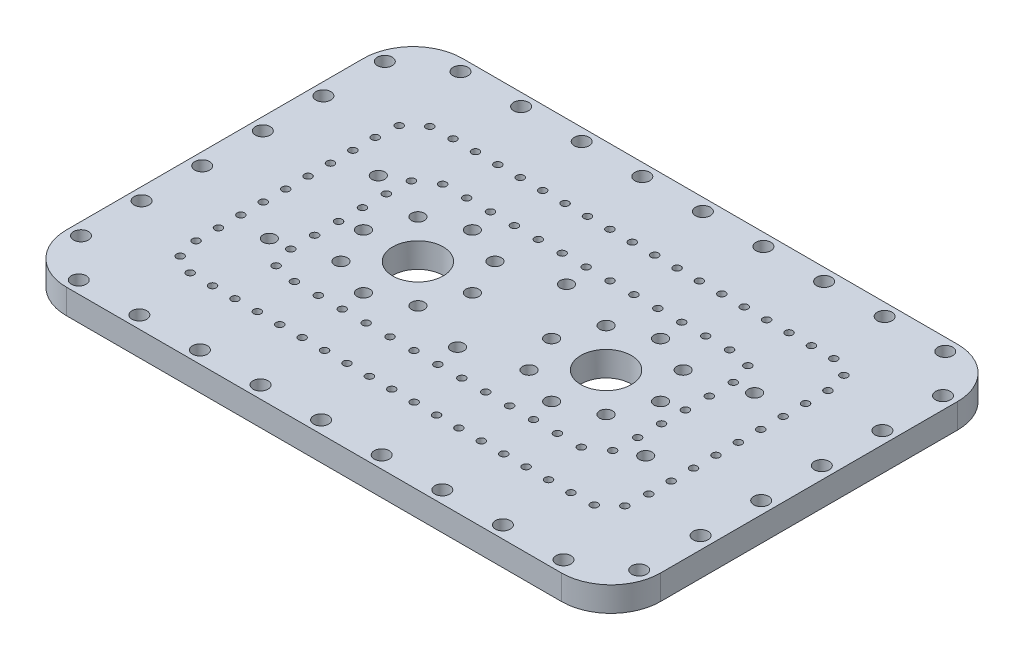
from build123d import *

# Parameters (mm, degrees)
SKETCH1_W                                        = 120
SKETCH1_H                                        = 80
BOSS_EXTRUDE1_DEPTH                              = 7
SKETCH2_W                                        = 110
SKETCH2_H                                        = 70
CUT_EXTRUDE1_DEPTH                               = 1.5
F_2_6_2_6_DIAMETER_HOLE1_D                       = 2.6
F_10_2_10_2_DIAMETER_HOLE1_D                     = 10.2
CBORE_FOR_M2_HEX_HEAD_MACHINE_SCREW1_D           = 2.6
CBORE_FOR_M2_HEX_HEAD_MACHINE_SCREW1_CBORE_D     = 5
CBORE_FOR_M2_HEX_HEAD_MACHINE_SCREW1_CBORE_DEPTH = 2.5
FILLET1_R                                        = 10
FILLET3_R                                        = 5
F_3_0MM_DOWEL_HOLE1_D                            = 3
CRVPATTERN1_OUTLINE_R                            = 1.5
CRVPATTERN1_DEPTH                                = 7
F_1_5MM_DOWEL_HOLE2_D                            = 1.5
CRVPATTERN3_OUTLINE_R                            = 0.75
CRVPATTERN3_DEPTH                                = 5.5
F_1_5MM_DOWEL_HOLE3_D                            = 1.5
CRVPATTERN4_OUTLINE_R                            = 0.75
CRVPATTERN4_DEPTH                                = 5.5
BOSS_EXTRUDE2_DEPTH                              = 1.45
SKETCH25_W                                       = 124.65453068
SKETCH25_H                                       = 86.700016861
CUT_EXTRUDE7_DEPTH                               = 2


# Read off the part's stored shape, not the designer's step: CrvPattern1, CrvPattern3, CrvPattern4
with BuildPart() as part:
    # Sketch1 → Boss-Extrude1 (new body)
    with BuildSketch(Plane(origin=(0, 7, 0), x_dir=(1, 0, 0), z_dir=(0, 1, 0))):
        Rectangle(SKETCH1_W, SKETCH1_H)
    extrude(amount=-BOSS_EXTRUDE1_DEPTH)

    # Sketch2 → Cut-Extrude1 (cut)
    with BuildSketch(Plane(origin=(0, 7, 0), x_dir=(-1, 0, 0), z_dir=(0, 1, 0))):
        Rectangle(SKETCH2_W, SKETCH2_H)
    extrude(amount=-CUT_EXTRUDE1_DEPTH, mode=Mode.SUBTRACT)

    # Ø2.6 (2.6) Diameter Hole1 (through all)
    with Locations(Plane(origin=(0, 5.5, 0), x_dir=(1, 0, 0), z_dir=(0, 1, 0))):
        with Locations((-38, -11), (0, 11), (-11.221825407, -7.778174593), (-19, -11), (-26.778174593, -7.778174593), (-26.778174593, 7.778174593), (-19, 11), (-11.221825407, 7.778174593), (11.221825407, 7.778174593), (19, 11), (26.778174593, 7.778174593), (30, 0), (26.778174593, -7.778174593), (19, -11), (11.221825407, -7.778174593), (-8, 0)):
            Hole(F_2_6_2_6_DIAMETER_HOLE1_D / 2)

    # Ø10.2 (10.2) Diameter Hole1 (through all)
    with Locations(Plane(origin=(0, 5.5, 0), x_dir=(1, 0, 0), z_dir=(0, 1, 0))):
        with Locations((19, 0), (-19, 0)):
            Hole(F_10_2_10_2_DIAMETER_HOLE1_D / 2)

    # CBORE for M2 Hex Head Machine Screw1 (through all)
    with Locations(Plane(origin=(0, 0, 0), x_dir=(-1, 0, 0), z_dir=(0, -1, 0))):
        with Locations((-8, 0), (30, 0), (38, 11), (-38, 11), (0, -11), (-38, -11), (26.778174593, -7.778174593), (38, -11), (19, -11), (11.221825407, -7.778174593), (8, 0), (11.221825407, 7.778174593), (19, 11), (26.778174593, 7.778174593), (0, 11), (-11.221825407, 7.778174593), (-19, 11), (-26.778174593, 7.778174593), (-30, 0), (-26.778174593, -7.778174593), (-19, -11), (-11.221825407, -7.778174593)):
            CounterBoreHole(CBORE_FOR_M2_HEX_HEAD_MACHINE_SCREW1_D / 2, CBORE_FOR_M2_HEX_HEAD_MACHINE_SCREW1_CBORE_D / 2, CBORE_FOR_M2_HEX_HEAD_MACHINE_SCREW1_CBORE_DEPTH)

    # Fillet1
    fillet1_edges = [part.edges().sort_by_distance(p)[0] for p in [
        (-60, 3.5, -40),
        (60, 3.5, -40),
        (60, 3.5, 40),
        (-60, 3.5, 40),
    ]]
    fillet(fillet1_edges, radius=FILLET1_R)

    # Fillet3
    fillet3_edges = [part.edges().sort_by_distance(p)[0] for p in [
        (-55, 6.25, 35),
        (-55, 6.25, -35),
        (55, 6.25, -35),
        (55, 6.25, 35),
    ]]
    fillet(fillet3_edges, radius=FILLET3_R)

    # Ø3.0mm Dowel Hole1 (through all)
    with Locations(Plane(origin=(0, 7, 0), x_dir=(1, 0, 0), z_dir=(0, 1, 0))):
        with Locations((50, 37.5)):
            Hole(F_3_0MM_DOWEL_HOLE1_D / 2)

    # CrvPattern1 outline → CrvPattern1 (cut)
    with BuildSketch(Plane(origin=(0, 0, 0), x_dir=(1, 0, 0), z_dir=(0, 1, 0))):
        with Locations((37.762537007, 37.5)):
            Circle(CRVPATTERN1_OUTLINE_R)
        with Locations((25.525074013, 37.5)):
            Circle(CRVPATTERN1_OUTLINE_R)
        with Locations((13.28761102, 37.5)):
            Circle(CRVPATTERN1_OUTLINE_R)
        with Locations((1.050148026, 37.5)):
            Circle(CRVPATTERN1_OUTLINE_R)
        with Locations((-11.187314967, 37.5)):
            Circle(CRVPATTERN1_OUTLINE_R)
        with Locations((-23.424777961, 37.5)):
            Circle(CRVPATTERN1_OUTLINE_R)
        with Locations((-35.662240954, 37.5)):
            Circle(CRVPATTERN1_OUTLINE_R)
        with Locations((-47.899703948, 37.5)):
            Circle(CRVPATTERN1_OUTLINE_R)
        with Locations((-57.320580195, 31.630676428)):
            Circle(CRVPATTERN1_OUTLINE_R)
        with Locations((-57.5, 19.406342516)):
            Circle(CRVPATTERN1_OUTLINE_R)
        with Locations((-57.5, 7.168879523)):
            Circle(CRVPATTERN1_OUTLINE_R)
        with Locations((-57.5, -5.068583471)):
            Circle(CRVPATTERN1_OUTLINE_R)
        with Locations((-57.5, -17.306046464)):
            Circle(CRVPATTERN1_OUTLINE_R)
        with Locations((-57.5, -29.543509458)):
            Circle(CRVPATTERN1_OUTLINE_R)
        with Locations((-50, -37.5)):
            Circle(CRVPATTERN1_OUTLINE_R)
        with Locations((-37.762537007, -37.5)):
            Circle(CRVPATTERN1_OUTLINE_R)
        with Locations((-25.525074013, -37.5)):
            Circle(CRVPATTERN1_OUTLINE_R)
        with Locations((-13.28761102, -37.5)):
            Circle(CRVPATTERN1_OUTLINE_R)
        with Locations((-1.050148026, -37.5)):
            Circle(CRVPATTERN1_OUTLINE_R)
        with Locations((11.187314967, -37.5)):
            Circle(CRVPATTERN1_OUTLINE_R)
        with Locations((23.424777961, -37.5)):
            Circle(CRVPATTERN1_OUTLINE_R)
        with Locations((35.662240954, -37.5)):
            Circle(CRVPATTERN1_OUTLINE_R)
        with Locations((47.899703948, -37.5)):
            Circle(CRVPATTERN1_OUTLINE_R)
        with Locations((57.320580195, -31.630676428)):
            Circle(CRVPATTERN1_OUTLINE_R)
        with Locations((57.5, -19.406342516)):
            Circle(CRVPATTERN1_OUTLINE_R)
        with Locations((57.5, -7.168879523)):
            Circle(CRVPATTERN1_OUTLINE_R)
        with Locations((57.5, 5.068583471)):
            Circle(CRVPATTERN1_OUTLINE_R)
        with Locations((57.5, 17.306046464)):
            Circle(CRVPATTERN1_OUTLINE_R)
        with Locations((57.5, 29.543509458)):
            Circle(CRVPATTERN1_OUTLINE_R)
    extrude(amount=CRVPATTERN1_DEPTH, mode=Mode.SUBTRACT)

    # Ø1.5mm Dowel Hole2 (through all)
    with Locations(Plane(origin=(0, 5.5, 0), x_dir=(1, 0, 0), z_dir=(0, 1, 0))):
        with Locations((40, 25)):
            Hole(F_1_5MM_DOWEL_HOLE2_D / 2)

    # CrvPattern3 outline → CrvPattern3 (cut)
    with BuildSketch(Plane(origin=(0, 0, 0), x_dir=(1, 0, 0), z_dir=(0, 1, 0))):
        with Locations((35.476401224, 25)):
            Circle(CRVPATTERN3_OUTLINE_R)
        with Locations((30.952802449, 25)):
            Circle(CRVPATTERN3_OUTLINE_R)
        with Locations((26.429203673, 25)):
            Circle(CRVPATTERN3_OUTLINE_R)
        with Locations((21.905604898, 25)):
            Circle(CRVPATTERN3_OUTLINE_R)
        with Locations((17.382006122, 25)):
            Circle(CRVPATTERN3_OUTLINE_R)
        with Locations((12.858407346, 25)):
            Circle(CRVPATTERN3_OUTLINE_R)
        with Locations((8.334808571, 25)):
            Circle(CRVPATTERN3_OUTLINE_R)
        with Locations((3.811209795, 25)):
            Circle(CRVPATTERN3_OUTLINE_R)
        with Locations((-0.71238898, 25)):
            Circle(CRVPATTERN3_OUTLINE_R)
        with Locations((-5.235987756, 25)):
            Circle(CRVPATTERN3_OUTLINE_R)
        with Locations((-9.759586532, 25)):
            Circle(CRVPATTERN3_OUTLINE_R)
        with Locations((-14.283185307, 25)):
            Circle(CRVPATTERN3_OUTLINE_R)
        with Locations((-18.806784083, 25)):
            Circle(CRVPATTERN3_OUTLINE_R)
        with Locations((-23.330382858, 25)):
            Circle(CRVPATTERN3_OUTLINE_R)
        with Locations((-27.853981634, 25)):
            Circle(CRVPATTERN3_OUTLINE_R)
        with Locations((-32.37758041, 25)):
            Circle(CRVPATTERN3_OUTLINE_R)
        with Locations((-36.901179185, 25)):
            Circle(CRVPATTERN3_OUTLINE_R)
        with Locations((-41.405574173, 24.798370687)):
            Circle(CRVPATTERN3_OUTLINE_R)
        with Locations((-44.64124129, 21.859806251)):
            Circle(CRVPATTERN3_OUTLINE_R)
        with Locations((-45, 17.382006122)):
            Circle(CRVPATTERN3_OUTLINE_R)
        with Locations((-45, 12.858407346)):
            Circle(CRVPATTERN3_OUTLINE_R)
        with Locations((-45, 8.334808571)):
            Circle(CRVPATTERN3_OUTLINE_R)
        with Locations((-45, 3.811209795)):
            Circle(CRVPATTERN3_OUTLINE_R)
        with Locations((-45, -0.71238898)):
            Circle(CRVPATTERN3_OUTLINE_R)
        with Locations((-45, -5.235987756)):
            Circle(CRVPATTERN3_OUTLINE_R)
        with Locations((-45, -9.759586532)):
            Circle(CRVPATTERN3_OUTLINE_R)
        with Locations((-45, -14.283185307)):
            Circle(CRVPATTERN3_OUTLINE_R)
        with Locations((-45, -18.806784083)):
            Circle(CRVPATTERN3_OUTLINE_R)
        with Locations((-43.931260104, -23.089529736)):
            Circle(CRVPATTERN3_OUTLINE_R)
        with Locations((-40, -25)):
            Circle(CRVPATTERN3_OUTLINE_R)
        with Locations((-35.476401224, -25)):
            Circle(CRVPATTERN3_OUTLINE_R)
        with Locations((-30.952802449, -25)):
            Circle(CRVPATTERN3_OUTLINE_R)
        with Locations((-26.429203673, -25)):
            Circle(CRVPATTERN3_OUTLINE_R)
        with Locations((-21.905604898, -25)):
            Circle(CRVPATTERN3_OUTLINE_R)
        with Locations((-17.382006122, -25)):
            Circle(CRVPATTERN3_OUTLINE_R)
        with Locations((-12.858407346, -25)):
            Circle(CRVPATTERN3_OUTLINE_R)
        with Locations((-8.334808571, -25)):
            Circle(CRVPATTERN3_OUTLINE_R)
        with Locations((-3.811209795, -25)):
            Circle(CRVPATTERN3_OUTLINE_R)
        with Locations((0.71238898, -25)):
            Circle(CRVPATTERN3_OUTLINE_R)
        with Locations((5.235987756, -25)):
            Circle(CRVPATTERN3_OUTLINE_R)
        with Locations((9.759586532, -25)):
            Circle(CRVPATTERN3_OUTLINE_R)
        with Locations((14.283185307, -25)):
            Circle(CRVPATTERN3_OUTLINE_R)
        with Locations((18.806784083, -25)):
            Circle(CRVPATTERN3_OUTLINE_R)
        with Locations((23.330382858, -25)):
            Circle(CRVPATTERN3_OUTLINE_R)
        with Locations((27.853981634, -25)):
            Circle(CRVPATTERN3_OUTLINE_R)
        with Locations((32.37758041, -25)):
            Circle(CRVPATTERN3_OUTLINE_R)
        with Locations((36.901179185, -25)):
            Circle(CRVPATTERN3_OUTLINE_R)
        with Locations((41.405574173, -24.798370687)):
            Circle(CRVPATTERN3_OUTLINE_R)
        with Locations((44.64124129, -21.859806251)):
            Circle(CRVPATTERN3_OUTLINE_R)
        with Locations((45, -17.382006122)):
            Circle(CRVPATTERN3_OUTLINE_R)
        with Locations((45, -12.858407346)):
            Circle(CRVPATTERN3_OUTLINE_R)
        with Locations((45, -8.334808571)):
            Circle(CRVPATTERN3_OUTLINE_R)
        with Locations((45, -3.811209795)):
            Circle(CRVPATTERN3_OUTLINE_R)
        with Locations((45, 0.71238898)):
            Circle(CRVPATTERN3_OUTLINE_R)
        with Locations((45, 5.235987756)):
            Circle(CRVPATTERN3_OUTLINE_R)
        with Locations((45, 9.759586532)):
            Circle(CRVPATTERN3_OUTLINE_R)
        with Locations((45, 14.283185307)):
            Circle(CRVPATTERN3_OUTLINE_R)
        with Locations((45, 18.806784083)):
            Circle(CRVPATTERN3_OUTLINE_R)
        with Locations((43.931260104, 23.089529736)):
            Circle(CRVPATTERN3_OUTLINE_R)
    extrude(amount=CRVPATTERN3_DEPTH, mode=Mode.SUBTRACT)

    # Ø1.5mm Dowel Hole3 (through all)
    with Locations(Plane(origin=(0, 0, 0), x_dir=(-1, 0, 0), z_dir=(0, -1, 0))):
        with Locations((-30, -16)):
            Hole(F_1_5MM_DOWEL_HOLE3_D / 2)

    # CrvPattern4 outline → CrvPattern4 (cut)
    with BuildSketch(Plane(origin=(0, 0, 0), x_dir=(1, 0, 0), z_dir=(0, 1, 0))):
        with Locations((25.171681469, -16)):
            Circle(CRVPATTERN4_OUTLINE_R)
        with Locations((20.343362939, -16)):
            Circle(CRVPATTERN4_OUTLINE_R)
        with Locations((15.515044408, -16)):
            Circle(CRVPATTERN4_OUTLINE_R)
        with Locations((10.686725877, -16)):
            Circle(CRVPATTERN4_OUTLINE_R)
        with Locations((5.858407346, -16)):
            Circle(CRVPATTERN4_OUTLINE_R)
        with Locations((1.030088816, -16)):
            Circle(CRVPATTERN4_OUTLINE_R)
        with Locations((-3.798229715, -16)):
            Circle(CRVPATTERN4_OUTLINE_R)
        with Locations((-8.626548246, -16)):
            Circle(CRVPATTERN4_OUTLINE_R)
        with Locations((-13.454866776, -16)):
            Circle(CRVPATTERN4_OUTLINE_R)
        with Locations((-18.283185307, -16)):
            Circle(CRVPATTERN4_OUTLINE_R)
        with Locations((-23.111503838, -16)):
            Circle(CRVPATTERN4_OUTLINE_R)
        with Locations((-27.939822369, -16)):
            Circle(CRVPATTERN4_OUTLINE_R)
        with Locations((-32.552422087, -15.079795689)):
            Circle(CRVPATTERN4_OUTLINE_R)
        with Locations((-34, -10.686725877)):
            Circle(CRVPATTERN4_OUTLINE_R)
        with Locations((-34, -5.858407346)):
            Circle(CRVPATTERN4_OUTLINE_R)
        with Locations((-34, -1.030088816)):
            Circle(CRVPATTERN4_OUTLINE_R)
        with Locations((-34, 3.798229715)):
            Circle(CRVPATTERN4_OUTLINE_R)
        with Locations((-34, 8.626548246)):
            Circle(CRVPATTERN4_OUTLINE_R)
        with Locations((-33.738324268, 13.423000937)):
            Circle(CRVPATTERN4_OUTLINE_R)
        with Locations((-30, 16)):
            Circle(CRVPATTERN4_OUTLINE_R)
        with Locations((-25.171681469, 16)):
            Circle(CRVPATTERN4_OUTLINE_R)
        with Locations((-20.343362939, 16)):
            Circle(CRVPATTERN4_OUTLINE_R)
        with Locations((-15.515044408, 16)):
            Circle(CRVPATTERN4_OUTLINE_R)
        with Locations((-10.686725877, 16)):
            Circle(CRVPATTERN4_OUTLINE_R)
        with Locations((-5.858407346, 16)):
            Circle(CRVPATTERN4_OUTLINE_R)
        with Locations((-1.030088816, 16)):
            Circle(CRVPATTERN4_OUTLINE_R)
        with Locations((3.798229715, 16)):
            Circle(CRVPATTERN4_OUTLINE_R)
        with Locations((8.626548246, 16)):
            Circle(CRVPATTERN4_OUTLINE_R)
        with Locations((13.454866776, 16)):
            Circle(CRVPATTERN4_OUTLINE_R)
        with Locations((18.283185307, 16)):
            Circle(CRVPATTERN4_OUTLINE_R)
        with Locations((23.111503838, 16)):
            Circle(CRVPATTERN4_OUTLINE_R)
        with Locations((27.939822369, 16)):
            Circle(CRVPATTERN4_OUTLINE_R)
        with Locations((32.552422087, 15.079795689)):
            Circle(CRVPATTERN4_OUTLINE_R)
        with Locations((34, 10.686725877)):
            Circle(CRVPATTERN4_OUTLINE_R)
        with Locations((34, 5.858407346)):
            Circle(CRVPATTERN4_OUTLINE_R)
        with Locations((34, 1.030088816)):
            Circle(CRVPATTERN4_OUTLINE_R)
        with Locations((34, -3.798229715)):
            Circle(CRVPATTERN4_OUTLINE_R)
        with Locations((34, -8.626548246)):
            Circle(CRVPATTERN4_OUTLINE_R)
        with Locations((33.738324268, -13.423000937)):
            Circle(CRVPATTERN4_OUTLINE_R)
    extrude(amount=CRVPATTERN4_DEPTH, mode=Mode.SUBTRACT)

    # Sketch23 → Boss-Extrude2 (add)
    with BuildSketch(Plane(origin=(0, 5.5, 0), x_dir=(1, 0, 0), z_dir=(0, 1, 0))):
        with BuildLine():
            ThreePointArc((52.5, -30), (51.767766953, -28.232233047), (50, -27.5))
            Line((50, -27.5), (50, -32.5))
            ThreePointArc((50, -32.5), (51.767766953, -31.767766953), (52.5, -30))
        make_face()
        with BuildLine():
            Line((50, -32.5), (50, -27.5))
            ThreePointArc((50, -27.5), (47.5, -30), (50, -32.5))
        make_face()
        with BuildLine():
            ThreePointArc((50, -32.5), (47.5, -30), (50, -27.5))
            Line((50, -27.5), (46, -27.5))
            Line((46, -27.5), (46, -32.5))
            Line((46, -32.5), (50, -32.5))
        make_face()
        with BuildLine():
            Line((46, -2.5), (50, -2.5))
            ThreePointArc((50, -2.5), (47.5, 0), (50, 2.5))
            Line((50, 2.5), (46, 2.5))
            Line((46, 2.5), (46, -2.5))
        make_face()
        with BuildLine():
            ThreePointArc((50, 2.5), (47.5, 0), (50, -2.5))
            Line((50, -2.5), (50, 2.5))
        make_face()
        with BuildLine():
            Line((50, 2.5), (50, -2.5))
            ThreePointArc((50, -2.5), (51.767766953, -1.767766953), (52.5, 0))
            ThreePointArc((52.5, 0), (51.767766953, 1.767766953), (50, 2.5))
        make_face()
        with BuildLine():
            Line((46, 27.5), (50, 27.5))
            ThreePointArc((50, 27.5), (47.5, 30), (50, 32.5))
            Line((50, 32.5), (46, 32.5))
            Line((46, 32.5), (46, 27.5))
        make_face()
        with BuildLine():
            ThreePointArc((50, 32.5), (47.5, 30), (50, 27.5))
            Line((50, 27.5), (50, 32.5))
        make_face()
        with BuildLine():
            Line((50, 32.5), (50, 27.5))
            ThreePointArc((50, 27.5), (51.767766953, 28.232233047), (52.5, 30))
            ThreePointArc((52.5, 30), (51.767766953, 31.767766953), (50, 32.5))
        make_face()
        with BuildLine():
            ThreePointArc((2.5, 30), (0, 27.5), (-2.5, 30))
            Line((-2.5, 30), (-2.5, 26))
            Line((-2.5, 26), (2.5, 26))
            Line((2.5, 26), (2.5, 30))
        make_face()
        with BuildLine():
            ThreePointArc((2.5, 30), (0, 32.5), (-2.5, 30))
            Line((-2.5, 30), (2.5, 30))
        make_face()
        with BuildLine():
            Line((2.5, 30), (-2.5, 30))
            ThreePointArc((-2.5, 30), (0, 27.5), (2.5, 30))
        make_face()
        with BuildLine():
            ThreePointArc((-2.5, -30), (0, -27.5), (2.5, -30))
            Line((2.5, -30), (2.5, -26))
            Line((2.5, -26), (-2.5, -26))
            Line((-2.5, -26), (-2.5, -30))
        make_face()
        with BuildLine():
            ThreePointArc((-2.5, -30), (0, -32.5), (2.5, -30))
            Line((2.5, -30), (-2.5, -30))
        make_face()
        with BuildLine():
            Line((-2.5, -30), (2.5, -30))
            ThreePointArc((2.5, -30), (0, -27.5), (-2.5, -30))
        make_face()
        with BuildLine():
            ThreePointArc((-50, -27.5), (-52.5, -30), (-50, -32.5))
            Line((-50, -32.5), (-50, -27.5))
        make_face()
        with BuildLine():
            Line((-50, -27.5), (-50, -32.5))
            ThreePointArc((-50, -32.5), (-48.232233047, -31.767766953), (-47.5, -30))
            ThreePointArc((-47.5, -30), (-48.232233047, -28.232233047), (-50, -27.5))
        make_face()
        with BuildLine():
            ThreePointArc((-47.5, -30), (-48.232233047, -31.767766953), (-50, -32.5))
            Line((-50, -32.5), (-46, -32.5))
            Line((-46, -32.5), (-46, -27.5))
            Line((-46, -27.5), (-50, -27.5))
            ThreePointArc((-50, -27.5), (-48.232233047, -28.232233047), (-47.5, -30))
        make_face()
        with BuildLine():
            ThreePointArc((-50, 32.5), (-52.5, 30), (-50, 27.5))
            Line((-50, 27.5), (-50, 32.5))
        make_face()
        with BuildLine():
            Line((-50, 32.5), (-50, 27.5))
            ThreePointArc((-50, 27.5), (-48.232233047, 28.232233047), (-47.5, 30))
            ThreePointArc((-47.5, 30), (-48.232233047, 31.767766953), (-50, 32.5))
        make_face()
        with BuildLine():
            ThreePointArc((-47.5, 30), (-48.232233047, 28.232233047), (-50, 27.5))
            Line((-50, 27.5), (-46, 27.5))
            Line((-46, 27.5), (-46, 32.5))
            Line((-46, 32.5), (-50, 32.5))
            ThreePointArc((-50, 32.5), (-48.232233047, 31.767766953), (-47.5, 30))
        make_face()
        with BuildLine():
            ThreePointArc((-50, 2.5), (-52.5, 0), (-50, -2.5))
            Line((-50, -2.5), (-50, 2.5))
        make_face()
        with BuildLine():
            Line((-50, 2.5), (-50, -2.5))
            ThreePointArc((-50, -2.5), (-48.232233047, -1.767766953), (-47.5, 0))
            ThreePointArc((-47.5, 0), (-48.232233047, 1.767766953), (-50, 2.5))
        make_face()
        with BuildLine():
            ThreePointArc((-47.5, 0), (-48.232233047, -1.767766953), (-50, -2.5))
            Line((-50, -2.5), (-46, -2.5))
            Line((-46, -2.5), (-46, 2.5))
            Line((-46, 2.5), (-50, 2.5))
            ThreePointArc((-50, 2.5), (-48.232233047, 1.767766953), (-47.5, 0))
        make_face()
    extrude(amount=BOSS_EXTRUDE2_DEPTH)

    # Sketch25 → Cut-Extrude7 (cut)
    with BuildSketch(Plane(origin=(0, 7, 0), x_dir=(1, 0, 0), z_dir=(0, 1, 0))):
        with Locations((-0.186051538, 0.248068718)):
            Rectangle(SKETCH25_W, SKETCH25_H)
    extrude(amount=-CUT_EXTRUDE7_DEPTH, mode=Mode.SUBTRACT)


solid = part.part
